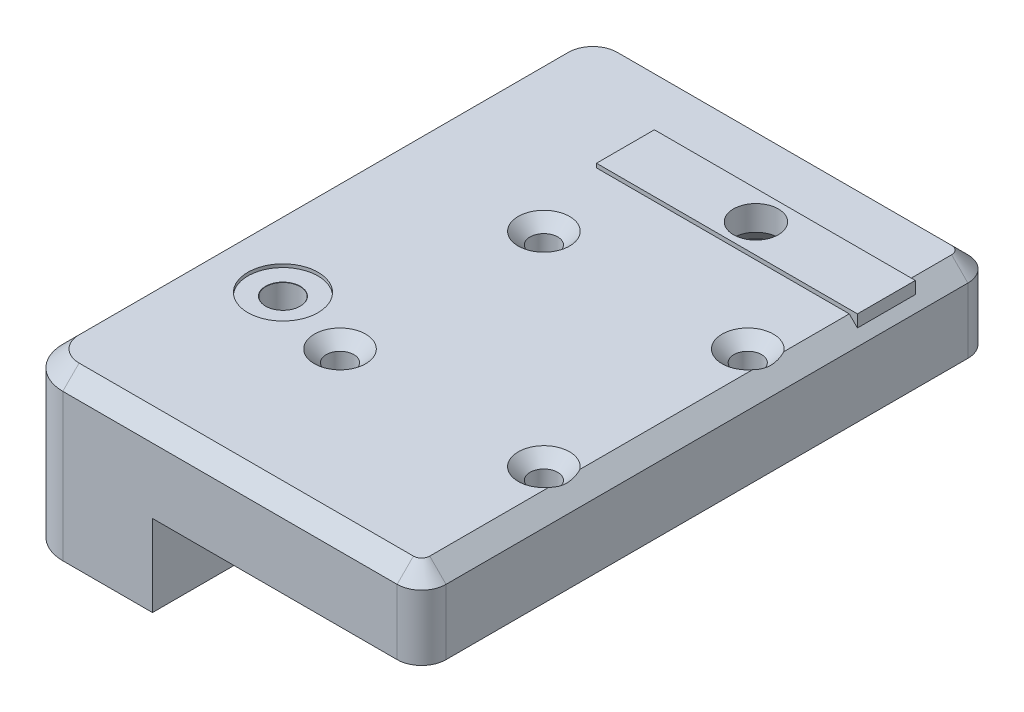
from build123d import *

# Parameters (mm, degrees)
SKETCH_1_W                   = 34
SKETCH_1_H                   = 70
EXTRUDE_317_DEPTH            = 10
SKETCH_7_W                   = 15
SKETCH_7_H                   = 70
EXTRUDE_2_DEPTH              = 10
HOLE_WIZARD_M3_D             = 3.4
HOLE_WIZARD_M3_CSINK_D       = 6.3
HOLE_WIZARD_M3_CSINK_ANGLE   = 90
SKETCH_19_W                  = 32
SKETCH_19_H                  = 62
CUT_EXTRUDE_2_DEPTH          = 5
SKETCH_17_W                  = 32
SKETCH_17_H                  = 7.1
EXTRUDE_2650_DEPTH           = 0.5
SKETCH_20_W                  = 16
SKETCH_20_H                  = 70
EXTRUDE_1_DEPTH              = 10
HOLE_WIZARD_M5_2_D           = 4.2
HOLE_WIZARD_M5_2_CSINK_D     = 5.05
HOLE_WIZARD_M5_2_CSINK_ANGLE = 90
FILLET_1_R                   = 3
FILLET_3_R                   = 5
SKETCH_18_R                  = 4.3
CUT_EXTRUDE_1_DEPTH          = 0.4
FILLET_2_R                   = 2
CHAMFER_2_SIZE               = 2


with BuildPart() as part:
    # Эскиз1 → Extrude 317 (new body)
    with BuildSketch(Plane(origin=(0, 0, 0), x_dir=(1, 0, 0), z_dir=(0, 1, 0))):
        Rectangle(SKETCH_1_W, SKETCH_1_H)
    extrude(amount=-EXTRUDE_317_DEPTH)

    # Эскиз7 → База2 (add)
    with BuildSketch(Plane(origin=(0, 0, 0), x_dir=(-1, 0, 0), z_dir=(0, -1, 0))):
        with Locations((24.5, 0)):
            Rectangle(SKETCH_7_W, SKETCH_7_H)
    extrude(amount=EXTRUDE_2_DEPTH)

    # Крепление каретки M3 (through all)
    with Locations(Plane(origin=(0, 0, 0), x_dir=(-1, 0, 0), z_dir=(0, 1, 0))):
        with Locations((-12.5, -9.5), (12.5, -9.5), (12.5, 15.5), (-12.5, 15.5)):
            CounterSinkHole(HOLE_WIZARD_M3_D / 2, HOLE_WIZARD_M3_CSINK_D / 2, counter_sink_angle=HOLE_WIZARD_M3_CSINK_ANGLE)

    # Эскиз19 → Вырез-Вытянуть2 (cut)
    with BuildSketch(Plane.XZ.offset(10)):
        with Locations((0, 3)):
            Rectangle(SKETCH_19_W, SKETCH_19_H)
    extrude(amount=-CUT_EXTRUDE_2_DEPTH, mode=Mode.SUBTRACT)

    # Эскиз17 → Extrude 2650 (add)
    with BuildSketch(Plane(origin=(0, 0, 0), x_dir=(1, 0, 0), z_dir=(0, 1, 0))):
        with Locations((0, 23)):
            Rectangle(SKETCH_17_W, SKETCH_17_H)
    extrude(amount=EXTRUDE_2650_DEPTH)

    # Эскиз16 → Hole Wizard M5 (revolve, cut)
    with BuildSketch(Plane(origin=(0, -5, -23), x_dir=(0, 0, -1), z_dir=(1, 0, 0))):
        Polygon((0, 0), (0, 23.152366702), (2.75, 21.5), (2.75, 2.45), (5.2, 0), align=None)
    revolve(axis=Axis((0, -11.35, -23), (0, 1, 0)), mode=Mode.SUBTRACT)

    # Эскиз20 → Бобышка-Вытянуть1 (add)
    with BuildSketch(Plane.XZ.offset(10)):
        with Locations((-24, 0)):
            Rectangle(SKETCH_20_W, SKETCH_20_H)
    extrude(amount=EXTRUDE_1_DEPTH)

    # Hole Wizard M5 2 (through all)
    with Locations(Plane(origin=(0, 0, 0), x_dir=(-1, 0, 0), z_dir=(0, 1, 0))):
        with Locations((22, 13)):
            CounterSinkHole(HOLE_WIZARD_M5_2_D / 2, HOLE_WIZARD_M5_2_CSINK_D / 2, counter_sink_angle=HOLE_WIZARD_M5_2_CSINK_ANGLE)

    # Скругление1
    fillet_1_edges = [part.edges().sort_by_distance(p)[0] for p in [
        (17, -5, 35),
        (17, -5, -35),
    ]]
    fillet(fillet_1_edges, radius=FILLET_1_R)

    # Скругление3
    fillet_3_edges = [part.edges().sort_by_distance(p)[0] for p in [
        (-32, -10, -35),
        (-32, -10, 35),
    ]]
    fillet(fillet_3_edges, radius=FILLET_3_R)

    # Эскиз18 → Вырез-Вытянуть1 (cut)
    with BuildSketch(Plane(origin=(0, 0, 0), x_dir=(1, 0, 0), z_dir=(0, 1, 0))):
        with Locations(Location((-22, -13, 0), (0, 0, 270))):
            Circle(SKETCH_18_R)
    extrude(amount=-CUT_EXTRUDE_1_DEPTH, mode=Mode.SUBTRACT)

    # Скругление2
    fillet_2_edges = [part.edges().sort_by_distance(p)[0] for p in [
        (16, -7.5, 34),
        (16, -7.5, -28),
        (-16, -7.5, -28),
        (-16, -7.5, 34),
    ]]
    fillet(fillet_2_edges, radius=FILLET_2_R)

    # Фаска2
    # the kernel refuses this chamfer: 2 mm, written as the material it takes off along each edge
    with BuildSketch(Plane(origin=(14, 0, 32), x_dir=(0, 0, 1), z_dir=(-1, 0, 0))) as chamfer_2_piece_1:
        Polygon((3 - CHAMFER_2_SIZE, 0), (3, -CHAMFER_2_SIZE), (3, 0), align=None)
    revolve(axis=Axis((14, 0, 32), (0, 1, 0)), revolution_arc=90, mode=Mode.SUBTRACT)
    with BuildSketch(Plane(origin=(17, 0, -32), x_dir=(-0.9996219169112968, 0.027495876610586365, 0), z_dir=(0, 0, 1))) as chamfer_2_piece_2_section:
        Polygon((CHAMFER_2_SIZE * 0.999621916911, CHAMFER_2_SIZE * 0.0274958766106), (-CHAMFER_2_SIZE * 0.0274958766106, CHAMFER_2_SIZE * 0.999621916911), (0, 0), align=None)
    chamfer_2_piece_2 = extrude(amount=64, mode=Mode.PRIVATE)
    chamfer_2_piece_2 = split(chamfer_2_piece_2, bisect_by=Plane(origin=(15.636280777, -0.291141314, -26.55), z_dir=(0, 0, -1)), keep=Keep.TOP, mode=Mode.PRIVATE)
    chamfer_2_piece_2 = split(chamfer_2_piece_2, bisect_by=Plane(origin=(16, -0.291141314, -29.275), z_dir=(-1, 0, 0)), keep=Keep.TOP, mode=Mode.PRIVATE)
    add(chamfer_2_piece_2, mode=Mode.SUBTRACT)
    with BuildSketch(Plane(origin=(17, 0, -32), x_dir=(-0.9996219169112968, 0.027495876610586365, 0), z_dir=(0, 0, 1))) as chamfer_2_piece_3_section:
        Polygon((CHAMFER_2_SIZE * 0.999621916911, CHAMFER_2_SIZE * 0.0274958766106), (-CHAMFER_2_SIZE * 0.0274958766106, CHAMFER_2_SIZE * 0.999621916911), (0, 0), align=None)
    chamfer_2_piece_3 = extrude(amount=64, mode=Mode.PRIVATE)
    chamfer_2_piece_3 = split(chamfer_2_piece_3, bisect_by=Plane(origin=(16.58353142, -0.786802168, -26.55), z_dir=(0, 0, -1)), keep=Keep.TOP, mode=Mode.PRIVATE)
    chamfer_2_piece_3 = split(chamfer_2_piece_3, bisect_by=Plane(origin=(16, -0.786802168, -29.275), z_dir=(1, 0, 0)), keep=Keep.TOP, mode=Mode.PRIVATE)
    add(chamfer_2_piece_3, mode=Mode.SUBTRACT)
    with BuildSketch(Plane(origin=(17, 0, -32), x_dir=(-0.9996219169112968, 0.027495876610586365, 0), z_dir=(0, 0, 1))) as chamfer_2_piece_4_section:
        Polygon((CHAMFER_2_SIZE * 0.999621916911, CHAMFER_2_SIZE * 0.0274958766106), (-CHAMFER_2_SIZE * 0.0274958766106, CHAMFER_2_SIZE * 0.999621916911), (0, 0), align=None)
    chamfer_2_piece_4 = extrude(amount=64, mode=Mode.PRIVATE)
    chamfer_2_piece_4 = split(chamfer_2_piece_4, bisect_by=Plane(origin=(16.58353142, -0.786802168, -26.55), z_dir=(0, 0, 1)), keep=Keep.TOP, mode=Mode.PRIVATE)
    chamfer_2_piece_4 = split(chamfer_2_piece_4, bisect_by=Plane(origin=(16, -0.786802168, -23), z_dir=(1, 0, 0)), keep=Keep.TOP, mode=Mode.PRIVATE)
    chamfer_2_piece_4 = split(chamfer_2_piece_4, bisect_by=Plane(origin=(16.58353142, -0.786802168, -19.45), z_dir=(0, 0, -1)), keep=Keep.TOP, mode=Mode.PRIVATE)
    add(chamfer_2_piece_4, mode=Mode.SUBTRACT)
    with BuildSketch(Plane(origin=(17, 0, -32), x_dir=(-0.9996219169112968, 0.027495876610586365, 0), z_dir=(0, 0, 1))) as chamfer_2_piece_5_section:
        Polygon((CHAMFER_2_SIZE * 0.999621916911, CHAMFER_2_SIZE * 0.0274958766106), (-CHAMFER_2_SIZE * 0.0274958766106, CHAMFER_2_SIZE * 0.999621916911), (0, 0), align=None)
    chamfer_2_piece_5 = extrude(amount=64, mode=Mode.PRIVATE)
    chamfer_2_piece_5 = split(chamfer_2_piece_5, bisect_by=Plane(origin=(16, -0.291141314, 6.275), z_dir=(-1, 0, 0)), keep=Keep.TOP, mode=Mode.PRIVATE)
    chamfer_2_piece_5 = split(chamfer_2_piece_5, bisect_by=Plane(origin=(15.636280777, -0.291141314, -19.45), z_dir=(0, 0, 1)), keep=Keep.TOP, mode=Mode.PRIVATE)
    add(chamfer_2_piece_5, mode=Mode.SUBTRACT)
    with BuildSketch(Plane(origin=(17, 0, -32), x_dir=(-0.9996219169112968, 0.027495876610586365, 0), z_dir=(0, 0, 1))) as chamfer_2_piece_6_section:
        Polygon((CHAMFER_2_SIZE * 0.999621916911, CHAMFER_2_SIZE * 0.0274958766106), (-CHAMFER_2_SIZE * 0.0274958766106, CHAMFER_2_SIZE * 0.999621916911), (0, 0), align=None)
    chamfer_2_piece_6 = extrude(amount=64, mode=Mode.PRIVATE)
    chamfer_2_piece_6 = split(chamfer_2_piece_6, bisect_by=Plane(origin=(16, -0.786802168, 6.275), z_dir=(1, 0, 0)), keep=Keep.TOP, mode=Mode.PRIVATE)
    chamfer_2_piece_6 = split(chamfer_2_piece_6, bisect_by=Plane(origin=(16.58353142, -0.786802168, -19.45), z_dir=(0, 0, 1)), keep=Keep.TOP, mode=Mode.PRIVATE)
    add(chamfer_2_piece_6, mode=Mode.SUBTRACT)
    with BuildSketch(Plane(origin=(14, 0, -32), x_dir=(0, 0, -1), z_dir=(-1, 0, 0))) as chamfer_2_piece_7:
        Polygon((3 - CHAMFER_2_SIZE, 0), (3, CHAMFER_2_SIZE), (3, 0), align=None)
    revolve(axis=Axis((14, 0, -32), (0, -1, 0)), revolution_arc=90, mode=Mode.SUBTRACT)
    with BuildSketch(Plane(origin=(-27, 0, -35), x_dir=(0, 0.02749587661058639, 0.9996219169112968), z_dir=(1, 0, 0))) as chamfer_2_piece_8:
        Polygon((CHAMFER_2_SIZE * 0.999621916911, CHAMFER_2_SIZE * 0.0274958766106), (-CHAMFER_2_SIZE * 0.0274958766106, CHAMFER_2_SIZE * 0.999621916911), (0, 0), align=None)
    extrude(amount=41, mode=Mode.SUBTRACT)
    with BuildSketch(Plane(origin=(-32, 0, -30), x_dir=(0.9996219169112968, 0.02749587661058639, 0), z_dir=(0, 0, 1))) as chamfer_2_piece_9:
        Polygon((CHAMFER_2_SIZE * 0.999621916911, -CHAMFER_2_SIZE * 0.0274958766106), (-CHAMFER_2_SIZE * 0.0274958766106, -CHAMFER_2_SIZE * 0.999621916911), (0, 0), align=None)
    extrude(amount=60, mode=Mode.SUBTRACT)
    with BuildSketch(Plane(origin=(-27, 0, 35), x_dir=(0, 0.027495876610586296, -0.9996219169112968), z_dir=(1, 0, 0))) as chamfer_2_piece_10:
        Polygon((CHAMFER_2_SIZE * 0.999621916911, -CHAMFER_2_SIZE * 0.0274958766106), (-CHAMFER_2_SIZE * 0.0274958766106, -CHAMFER_2_SIZE * 0.999621916911), (0, 0), align=None)
    extrude(amount=41, mode=Mode.SUBTRACT)
    with BuildSketch(Plane(origin=(-27, 0, -30), x_dir=(0, 0, -1), z_dir=(1, 0, 0))) as chamfer_2_piece_11:
        Polygon((5 - CHAMFER_2_SIZE, 0), (5, -CHAMFER_2_SIZE), (5, 0), align=None)
    revolve(axis=Axis((-27, 0, -30), (0, 1, 0)), revolution_arc=90, mode=Mode.SUBTRACT)
    with BuildSketch(Plane(origin=(-27, 0, 30), x_dir=(-1, 0, 0), z_dir=(0, 0, -1))) as chamfer_2_piece_12:
        Polygon((5 - CHAMFER_2_SIZE, 0), (5, -CHAMFER_2_SIZE), (5, 0), align=None)
    revolve(axis=Axis((-27, 0, 30), (0, 1, 0)), revolution_arc=90, mode=Mode.SUBTRACT)


solid = part.part
